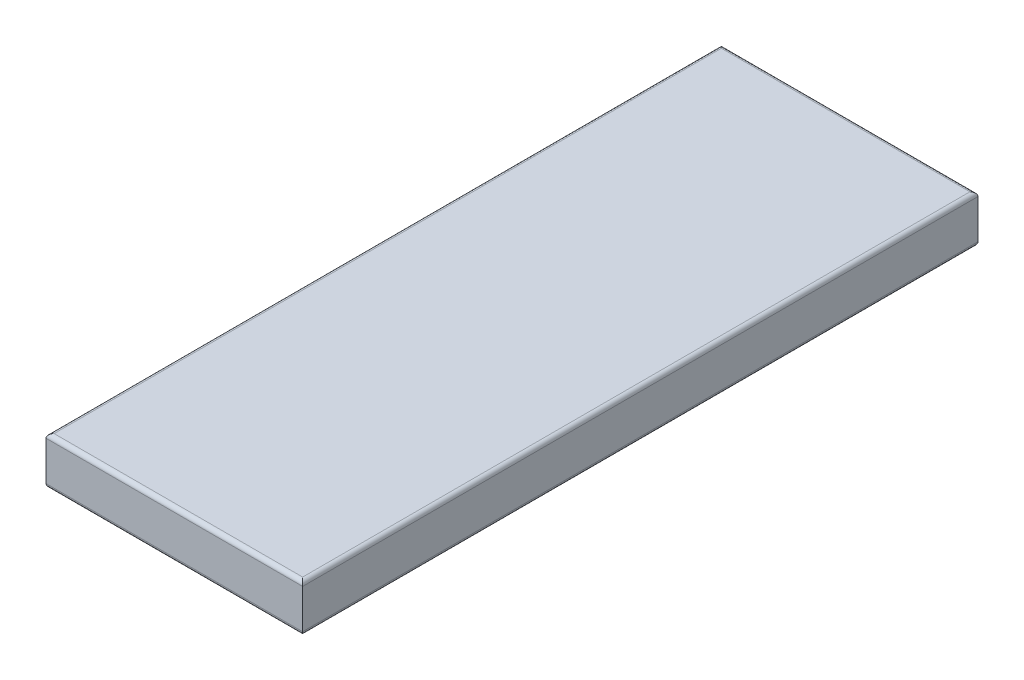
from build123d import *

# Parameters (mm, degrees)
SKETCH_1_W      = 19
SKETCH_1_H      = 3.5
EXTRUDE_1_DEPTH = 50
FILLET_1_R      = 0.3


with BuildPart() as part:
    # Эскиз1 → Бобышка-Вытянуть1 (new body)
    with BuildSketch(Plane.XY):
        Rectangle(SKETCH_1_W, SKETCH_1_H)
    extrude(amount=EXTRUDE_1_DEPTH)

    # Скругление1
    fillet_1_edges = [part.edges().sort_by_distance(p)[0] for p in [
        (-9.5, -1.75, 25),
        (0, -1.75, 50),
        (9.5, -1.75, 25),
        (0, -1.75, 0),
        (9.5, 1.75, 25),
        (0, 1.75, 50),
        (-9.5, 1.75, 25),
        (0, 1.75, 0),
    ]]
    fillet(fillet_1_edges, radius=FILLET_1_R)


solid = part.part
